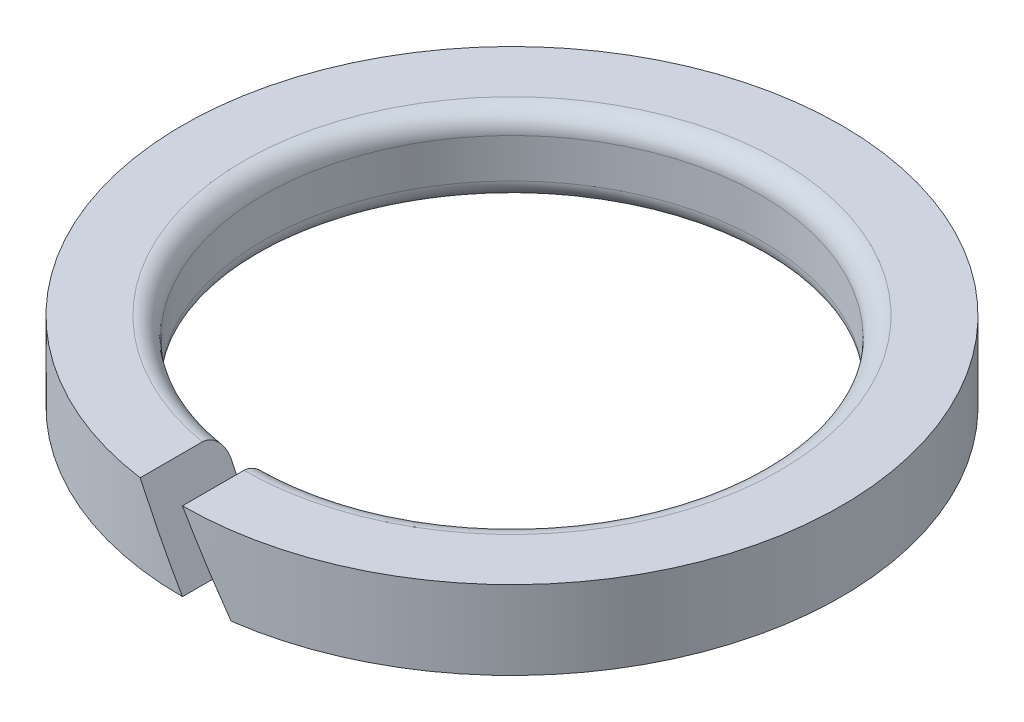
from build123d import *

# Parameters (mm, degrees)
BODYSKE_R      = 33.5
BODYSKE_R_2    = 25.25
BASEBODY_DEPTH = 8
SLIT_DEPTH     = 49.046852134
FILLET1_R      = 2


with BuildPart() as part:
    # BodySke → BaseBody (new body)
    with BuildSketch(Plane(origin=(0, 0, 0), x_dir=(1, 0, 0), z_dir=(0, 1, 0))):
        Circle(BODYSKE_R)
        Circle(BODYSKE_R_2, mode=Mode.SUBTRACT)
    extrude(amount=BASEBODY_DEPTH)

    # SlitSke → Slit (cut, through all)
    with BuildSketch(Plane.XY):
        Polygon((0, 0), (-4.618802154, 8), (0, 8), (4.618802154, 0), align=None)
    extrude(amount=SLIT_DEPTH, mode=Mode.SUBTRACT)

    # Fillet1
    fillet1_edges = [part.edges().sort_by_distance(p)[0] for p in [
        (-17.854446225, 0, -17.854446225),
        (-16.139048076, 8, -19.418898712),
    ]]
    fillet(fillet1_edges, radius=FILLET1_R)


solid = part.part
